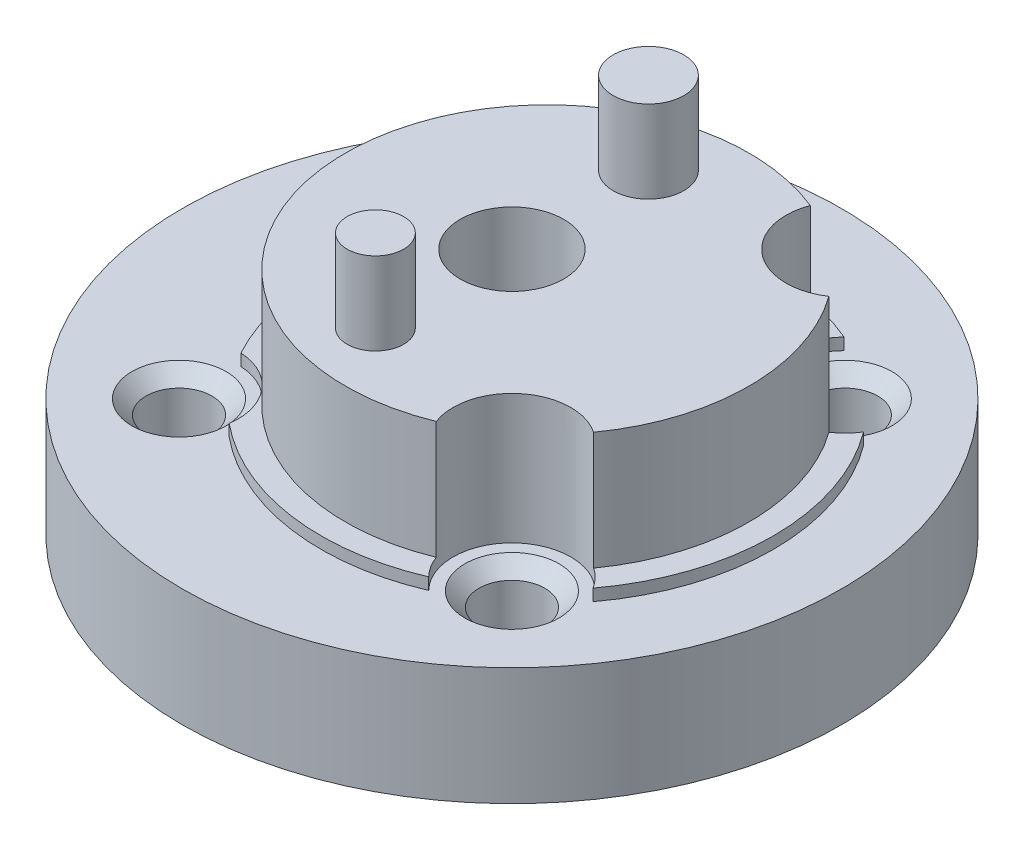
from build123d import *

# Parameters (mm, degrees)
SKETCH1_R           = 14
BOSS_EXTRUDE1_DEPTH = 5
SKETCH2_R           = 9.6
BOSS_EXTRUDE2_DEPTH = 0.5
SKETCH3_R           = 8.575
BOSS_EXTRUDE3_DEPTH = 5
SKETCH4_R           = 1.4
CUT_EXTRUDE1_DEPTH  = 21.548722588
CIRPATTERN1_COUNT   = 4
SKETCH5_R           = 2.5
CUT_EXTRUDE2_DEPTH  = 21.548722588
CHAMFER1_SIZE       = 0.6
SKETCH6_R           = 4.35
CUT_EXTRUDE3_DEPTH  = 2.5
SKETCH7_R           = 2.2
CUT_EXTRUDE4_DEPTH  = 6.5
SKETCH8_R           = 1.5
SKETCH8_R_2         = 1.2
BOSS_EXTRUDE4_DEPTH = 3.5


with BuildPart() as part:
    # Sketch1 → Boss-Extrude1 (new body)
    with BuildSketch(Plane(origin=(0, 0, 0), x_dir=(1, 0, 0), z_dir=(0, 1, 0))):
        Circle(SKETCH1_R)
    extrude(amount=BOSS_EXTRUDE1_DEPTH)

    # Sketch2 → Boss-Extrude2 (add)
    with BuildSketch(Plane(origin=(0, 5, 0), x_dir=(1, 0, 0), z_dir=(0, 1, 0))):
        with Locations((1.5, 0)):
            Circle(SKETCH2_R)
    extrude(amount=BOSS_EXTRUDE2_DEPTH)

    # Sketch3 → Boss-Extrude3 (add)
    with BuildSketch(Plane(origin=(0, 5.5, 0), x_dir=(1, 0, 0), z_dir=(0, 1, 0))):
        with Locations((1.5, 0)):
            Circle(SKETCH3_R)
    extrude(amount=BOSS_EXTRUDE3_DEPTH)

    # Sketch4 → Cut-Extrude1 (cut, through all)
    with BuildSketch(Plane(origin=(0, 5, 0), x_dir=(1, 0, 0), z_dir=(0, 1, 0))):
        with Locations((-7.071067812, 7.071067812)):
            Circle(SKETCH4_R)
    cut_extrude1 = extrude(amount=-CUT_EXTRUDE1_DEPTH, mode=Mode.SUBTRACT)

    # CirPattern1: Cut-Extrude1 ×4 about axis
    cirpattern1_axis = Axis((0, 5, 0), (0, -1, 0))
    for i in range(1, CIRPATTERN1_COUNT):
        add(cut_extrude1.rotate(cirpattern1_axis, i * 360 / CIRPATTERN1_COUNT), mode=Mode.SUBTRACT)

    # Sketch5 → Cut-Extrude2 (cut, through all)
    with BuildSketch(Plane(origin=(0, 5, 0), x_dir=(1, 0, 0), z_dir=(0, 1, 0))):
        with Locations((-7.071067812, 7.071067812)):
            Circle(SKETCH5_R)
        with Locations((7.071067812, 7.071067812)):
            Circle(SKETCH5_R)
        with Locations((7.071067812, -7.071067812)):
            Circle(SKETCH5_R)
        with Locations((-7.071067812, -7.071067812)):
            Circle(SKETCH5_R)
    extrude(amount=CUT_EXTRUDE2_DEPTH, mode=Mode.SUBTRACT)

    # Chamfer1
    chamfer1_edges = [part.edges().sort_by_distance(p)[0] for p in [
        (-7.071067812, 5, 8.471067812),
        (8.471067812, 5, 7.071067812),
        (7.071067812, 5, -8.471067812),
        (-8.471067812, 5, -7.071067812),
    ]]
    chamfer(chamfer1_edges, length=CHAMFER1_SIZE)

    # Sketch6 → Cut-Extrude3 (cut)
    with BuildSketch(Plane.XZ):
        Circle(SKETCH6_R)
    extrude(amount=-CUT_EXTRUDE3_DEPTH, mode=Mode.SUBTRACT)

    # Sketch7 → Cut-Extrude4 (cut)
    with BuildSketch(Plane(origin=(0, 10.5, 0), x_dir=(1, 0, 0), z_dir=(0, 1, 0))):
        Circle(SKETCH7_R)
    extrude(amount=-CUT_EXTRUDE4_DEPTH, mode=Mode.SUBTRACT)

    # Sketch8 → Boss-Extrude4 (add)
    with BuildSketch(Plane(origin=(0, 10.5, 0), x_dir=(1, 0, 0), z_dir=(0, 1, 0))):
        with Locations((0, 5.8)):
            Circle(SKETCH8_R)
        with Locations((0, -5.8)):
            Circle(SKETCH8_R_2)
    extrude(amount=BOSS_EXTRUDE4_DEPTH)


solid = part.part
